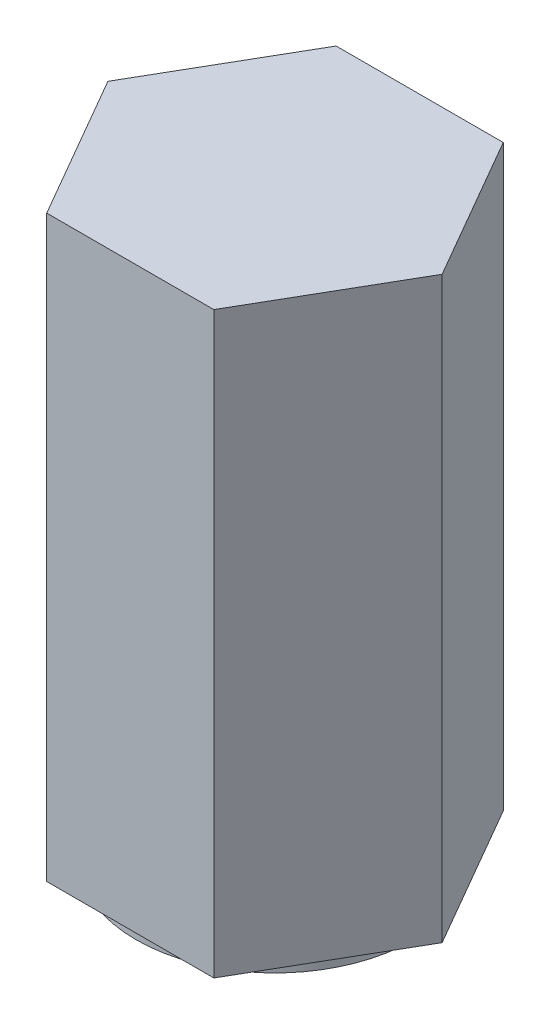
from build123d import *

# Parameters (mm, degrees)
SALIENTE_EXTRUIR1_DEPTH = 100
CROQUIS2_R              = 24
SALIENTE_EXTRUIR2_DEPTH = 2
CROQUIS3_R              = 17.5
CORTAR_EXTRUIR1_DEPTH   = 90
REDONDEO1_R             = 5
CORTAR_BARRER2_PITCH    = 2.1


with BuildPart() as part:
    # Croquis1 → Saliente-Extruir1 (new body)
    with BuildSketch(Plane(origin=(0, 0, 0), x_dir=(1, 0, 0), z_dir=(0, 1, 0))):
        Polygon((28.867513459, 0), (14.43375673, 25), (-14.43375673, 25), (-28.867513459, 0), (-14.43375673, -25), (14.43375673, -25), align=None)
    extrude(amount=SALIENTE_EXTRUIR1_DEPTH)

    # Croquis2 → Saliente-Extruir2 (add)
    with BuildSketch(Plane.XZ):
        with Locations(Location((0, 0, 0), (0, 0, 90))):
            Circle(CROQUIS2_R)
    extrude(amount=SALIENTE_EXTRUIR2_DEPTH)

    # Croquis3 → Cortar-Extruir1 (cut)
    with BuildSketch(Plane.XZ.offset(2)):
        with Locations(Location((0, 0, 0), (0, 0, 270))):
            Circle(CROQUIS3_R)
    extrude(amount=-CORTAR_EXTRUIR1_DEPTH, mode=Mode.SUBTRACT)

    # Redondeo1
    redondeo1_edges = [part.edges().sort_by_distance(p)[0] for p in [
        (0, 88, 17.5),
    ]]
    fillet(redondeo1_edges, radius=REDONDEO1_R)

    # Cortar-Barrer2: the profile of Croquis4 screwed along a right-hand helix of 9.52381 turns, 10 arcs to a turn; built about Z, then put on its axis
    cortar_barrer2_z = Axis((0, 0, 0), (0, 0, 1))
    cortar_barrer2_corners = [(17.267949192, 0, 0.856730346), (19, 0, -0.143269654), (17.267949192, 0, -1.143269654)]
    with BuildLine(mode=Mode.PRIVATE) as cortar_barrer2_profile:
        Line(cortar_barrer2_corners[0], cortar_barrer2_corners[1])
        Line(cortar_barrer2_corners[1], cortar_barrer2_corners[2])
        Line(cortar_barrer2_corners[2], cortar_barrer2_corners[0])
    cortar_barrer2_cap = Face(cortar_barrer2_profile.wire())
    cortar_barrer2_turn_angles = [0, 18, 36, 54, 72, 90, 108, 126, 144, 162, 180, 198, 216, 234, 252, 270, 288, 306, 324, 342, 360]
    cortar_barrer2_turn_weights = [1, 0.9510565162951535, 1, 0.9510565162951535, 1, 0.9510565162951535, 1, 0.9510565162951535, 1, 0.9510565162951535, 1, 0.9510565162951535, 1, 0.9510565162951535, 1, 0.9510565162951535, 1, 0.9510565162951535, 1, 0.9510565162951535, 1]
    cortar_barrer2_turn_rails = [Edge.make_bspline([Vector(p[0], p[1], 0).rotate(cortar_barrer2_z, cortar_barrer2_turn_angles[k]) / cortar_barrer2_turn_weights[k] + Vector(0, 0, p[2] + CORTAR_BARRER2_PITCH * cortar_barrer2_turn_angles[k] / 360) for k in range(21)], [0, 0, 0, 1, 1, 2, 2, 3, 3, 4, 4, 5, 5, 6, 6, 7, 7, 8, 8, 9, 9, 10, 10, 10], 2, cortar_barrer2_turn_weights) for p in cortar_barrer2_corners]
    cortar_barrer2_turn_sides = [Face.make_surface_from_curves(cortar_barrer2_turn_rails[p[0]], cortar_barrer2_turn_rails[p[1]]) for p in [(0, 1), (1, 2), (2, 0)]]
    cortar_barrer2_last_angles = [3240, 3258, 3276, 3294, 3312, 3330, 3348, 3366, 3384, 3402, 3420, 3424.285714286, 3428.571428571]
    cortar_barrer2_last_weights = [1, 0.9510565162951535, 1, 0.9510565162951535, 1, 0.9510565162951535, 1, 0.9510565162951535, 1, 0.9510565162951535, 1, 0.9972037971811826, 1]
    cortar_barrer2_last_rails = [Edge.make_bspline([Vector(p[0], p[1], 0).rotate(cortar_barrer2_z, cortar_barrer2_last_angles[k]) / cortar_barrer2_last_weights[k] + Vector(0, 0, p[2] + CORTAR_BARRER2_PITCH * cortar_barrer2_last_angles[k] / 360) for k in range(13)], [0, 0, 0, 1, 1, 2, 2, 3, 3, 4, 4, 5, 5, 6, 6, 6], 2, cortar_barrer2_last_weights) for p in cortar_barrer2_corners]
    cortar_barrer2_last_sides = [Face.make_surface_from_curves(cortar_barrer2_last_rails[p[0]], cortar_barrer2_last_rails[p[1]]) for p in [(0, 1), (1, 2), (2, 0)]]
    cortar_barrer2 = Plane(origin=(0, -2, 0), x_dir=(1, 0, 0), z_dir=(0, 1, 0)) * Solid(Shell([*[p.moved(Location((0, 0, CORTAR_BARRER2_PITCH * i))) for i in range(9) for p in cortar_barrer2_turn_sides], *cortar_barrer2_last_sides, cortar_barrer2_cap, cortar_barrer2_cap.rotate(cortar_barrer2_z, 3428.571428571).moved(Location((0, 0, CORTAR_BARRER2_PITCH * 3428.571428571 / 360)))]))
    add(cortar_barrer2, mode=Mode.SUBTRACT)


solid = part.part
